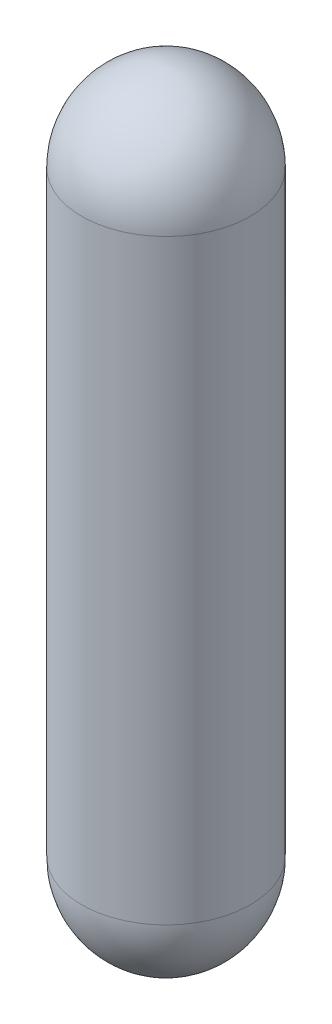
from build123d import *


with BuildPart() as part:
    # Sketch1 → Revolve1 (revolve)
    with BuildSketch(Plane.XY):
        with BuildLine():
            Line((0, 1768.632392295), (0, 1771.172392295))
            ThreePointArc((0, 1771.172392295), (155.012448731, 1700.797739378), (218.401449244, 1542.8))
            Line((218.401449244, 1542.8), (218.401449244, 0))
            ThreePointArc((218.401449244, 0), (155.169968435, -158.288533698), (0, -228.827607705))
            Line((0, -228.827607705), (0, -226.287607705))
            ThreePointArc((0, -226.287607705), (152.992627509, -156.294745346), (215.263788015, 0))
            Line((215.263788015, 0), (215.263788015, 1542.8))
            ThreePointArc((215.263788015, 1542.8), (152.835337007, 1698.804188408), (0, 1768.632392295))
        make_face()
    revolve(axis=Axis((0, 0, 0), (0, 1, 0)))


solid = part.part
